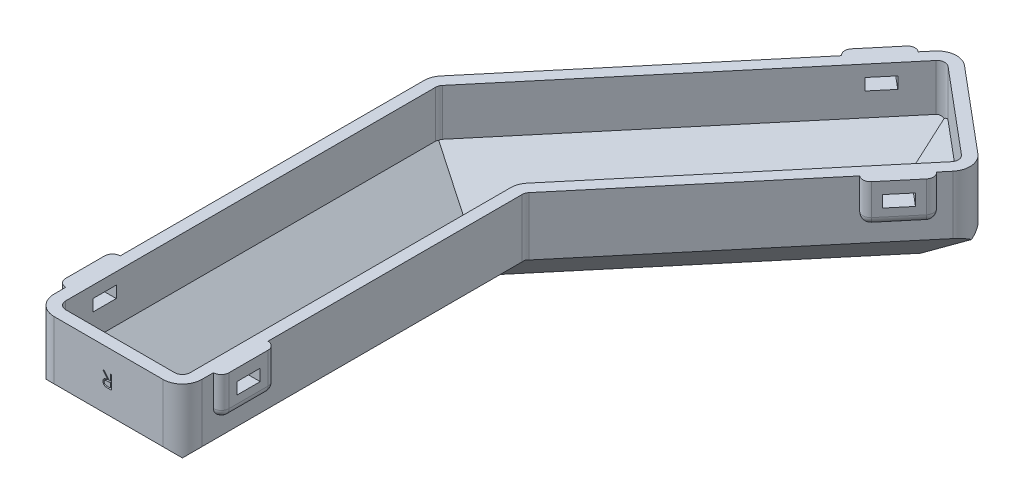
from build123d import *

# Parameters (mm, degrees)
BOSS_EXTRUDE1_DEPTH     = 25
CUT_EXTRUDE1_DEPTH      = 22
CHAMFER1_SIZE           = 10
FILLET1_R               = 2
FILLET2_R               = 5
SKETCH3_W               = 14
SKETCH3_H               = 10
BOSS_EXTRUDE2_DEPTH     = 2
SKETCH4_W               = 14
SKETCH4_H               = 10
BOSS_EXTRUDE3_DEPTH     = 2
CUT_EXTRUDE2_DEPTH      = 111.216138206
CUT_EXTRUDE2_DEPTH_BACK = 111.216138206
SKETCH5_W               = 6
SKETCH5_H               = 3
SKETCH6_W               = 14
SKETCH6_H               = 10
BOSS_EXTRUDE4_DEPTH     = 2
SKETCH7_W               = 14
SKETCH7_H               = 10
BOSS_EXTRUDE5_DEPTH     = 2
CUT_EXTRUDE3_DEPTH      = 110.938912569
CUT_EXTRUDE3_DEPTH_BACK = 110.938912569
SKETCH8_W               = 6
SKETCH8_H               = 3
FILLET4_R               = 2
CUT_EXTRUDE4_DEPTH      = 0.5


with BuildPart() as part:
    # Sketch1 → Boss-Extrude1 (new body)
    with BuildSketch(Plane(origin=(0, 0, 0), x_dir=(1, 0, 0), z_dir=(0, 1, 0))):
        Polygon((19, -95), (19, -6.915434451), (72.405729291, 56.731035297), (43.296040453, 81.156964465), (-19, 6.915434451), (-19, -95), align=None)
    extrude(amount=BOSS_EXTRUDE1_DEPTH)

    # Sketch2 → Cut-Extrude1 (cut)
    with BuildSketch(Plane(origin=(0, 25, 0), x_dir=(1, 0, 0), z_dir=(0, 1, 0))):
        Polygon((43.665810953, 76.930468306), (68.179233133, 56.361264796), (16, -5.823523748), (16, -92), (-16, -92), (-16, 5.823523748), align=None)
    extrude(amount=-CUT_EXTRUDE1_DEPTH, mode=Mode.SUBTRACT)

    # Chamfer1
    chamfer1_edges = [part.edges().sort_by_distance(p)[0] for p in [
        (13.832905476, 3, -41.376996027),
        (55.922522043, 3, -66.645866551),
        (42.089616566, 3, -25.268870524),
        (16, 3, 48.911761874),
        (0, 3, 92),
        (-16, 3, 43.088238126),
        (-19, 0, 44.042282774),
        (12.148020226, 0, -44.036199458),
        (57.850884872, 0, -68.943999881),
        (45.702864646, 0, -24.907800423),
        (19, 0, 50.957717226),
        (0, 0, 95),
    ]]
    chamfer(chamfer1_edges, length=CHAMFER1_SIZE)

    # Fillet1
    fillet1_edges = [part.edges().sort_by_distance(p)[0] for p in [
        (19, 17.5, 6.915434451),
        (43.665810953, 19, -76.930468306),
        (68.179233133, 19, -56.361264796),
        (16, 19, 92),
        (-16, 19, 92),
        (-16, 19, -5.823523748),
    ]]
    fillet(fillet1_edges, radius=FILLET1_R)

    # Fillet2
    fillet2_edges = [part.edges().sort_by_distance(p)[0] for p in [
        (-19, 17.5, 95),
        (-19, 17.5, -6.915434451),
        (43.296040453, 17.5, -81.156964465),
        (72.405729291, 17.5, -56.731035297),
        (19, 17.5, 95),
        (16, 19, 5.823523748),
    ]]
    fillet(fillet2_edges, radius=FILLET2_R)

    # Sketch3 → Boss-Extrude2 (add)
    with BuildSketch(Plane(origin=(-14.554844419, 0, -12.212964584), x_dir=(-0.6427876096865406, 0, 0.7660444431189771), z_dir=(-0.766044443118977, 0, -0.6427876096865405))):
        with Locations((-75, 20)):
            Rectangle(SKETCH3_W, SKETCH3_H)
    extrude(amount=BOSS_EXTRUDE2_DEPTH)

    # Sketch4 → Boss-Extrude3 (add)
    with BuildSketch(Plane(origin=(14.554844419, 0, 12.212964584), x_dir=(0.6427876096865404, 0, -0.7660444431189771), z_dir=(0.7660444431189771, 0, 0.6427876096865404))):
        with Locations((75, 20)):
            Rectangle(SKETCH4_W, SKETCH4_H)
    extrude(amount=BOSS_EXTRUDE3_DEPTH)

    # Sketch5 → Cut-Extrude2 (cut, two sides: drawn at the far end of the back side and taken through both)
    with BuildSketch(Plane(origin=(16.086933305, 0, 13.498539803), x_dir=(0.64278760968654, 0, -0.7660444431189776), z_dir=(0.7660444431189775, 0, 0.6427876096865399)).offset(-CUT_EXTRUDE2_DEPTH_BACK)):
        with Locations((75, 20.5)):
            Rectangle(SKETCH5_W, SKETCH5_H)
    extrude(amount=CUT_EXTRUDE2_DEPTH + CUT_EXTRUDE2_DEPTH_BACK, mode=Mode.SUBTRACT)

    # Sketch6 → Boss-Extrude4 (add)
    with BuildSketch(Plane.ZY.offset(19)):
        with Locations((80, 20)):
            Rectangle(SKETCH6_W, SKETCH6_H)
    extrude(amount=BOSS_EXTRUDE4_DEPTH)

    # Sketch7 → Boss-Extrude5 (add)
    with BuildSketch(Plane(origin=(19, 0, 0), x_dir=(0, 0, -1), z_dir=(1, 0, 0))):
        with Locations((-80, 20)):
            Rectangle(SKETCH7_W, SKETCH7_H)
    extrude(amount=BOSS_EXTRUDE5_DEPTH)

    # Sketch8 → Cut-Extrude3 (cut, two sides: drawn at the far end of the back side and taken through both)
    with BuildSketch(Plane(origin=(21, 0, 0), x_dir=(0, 0, -1), z_dir=(1, 0, 0)).offset(-CUT_EXTRUDE3_DEPTH_BACK)):
        with Locations((-80, 20.5)):
            Rectangle(SKETCH8_W, SKETCH8_H)
    extrude(amount=CUT_EXTRUDE3_DEPTH + CUT_EXTRUDE3_DEPTH_BACK, mode=Mode.SUBTRACT)

    # Fillet4
    # the kernel refuses this fillet: 2 mm, written as the material it takes off along each edge
    with BuildSketch(Plane(origin=(36.868164356, 17, -73.496520034), x_dir=(-0.7660444431189771, 0, -0.6427876096865406), z_dir=(0.6427876096865406, 0, -0.7660444431189771))) as fillet4_piece_1_section:
        Polygon((0, 0), (FILLET4_R * 1.02, 0), (FILLET4_R * 1.02, -FILLET4_R * 1.02), (0, -FILLET4_R * 1.02), align=None)
    fillet4_piece_1 = extrude(amount=FILLET4_R * 1.02, mode=Mode.PRIVATE)
    fillet4_piece_1 = fillet4_piece_1 - Plane(origin=(36.868164356, 17, -73.496520034), x_dir=(0.5416752204197013, 0.7071067811865475, 0.4545194776720445), z_dir=(0.6427876096865406, 0, -0.7660444431189771)) * Sphere(FILLET4_R, mode=Mode.PRIVATE)
    add(fillet4_piece_1, mode=Mode.SUBTRACT)
    with BuildSketch(Plane(origin=(30.440288259, 17, -65.836075602), x_dir=(-0.7660444431189771, 0, -0.6427876096865406), z_dir=(0, -1, 0))) as fillet4_piece_2_section:
        Polygon((0, 0), (FILLET4_R * 1.02, 0), (FILLET4_R * 1.02, -FILLET4_R * 1.02), (0, -FILLET4_R * 1.02), align=None)
    fillet4_piece_2 = extrude(amount=FILLET4_R * 1.02, mode=Mode.PRIVATE)
    fillet4_piece_2 = fillet4_piece_2 - Plane(origin=(30.440288259, 17, -65.836075602), x_dir=(0.9961946980917457, -1.0048591735576166e-15, -0.08715574274765664), z_dir=(0, -1, 0)) * Sphere(FILLET4_R, mode=Mode.PRIVATE)
    add(fillet4_piece_2, mode=Mode.SUBTRACT)
    with BuildSketch(Plane(origin=(59.549977097, 17, -41.410146434), x_dir=(-0.6427876096865404, 0, 0.7660444431189771), z_dir=(0, -1, 0))) as fillet4_piece_3_section:
        Polygon((0, 0), (FILLET4_R * 1.02, 0), (FILLET4_R * 1.02, -FILLET4_R * 1.02), (0, -FILLET4_R * 1.02), align=None)
    fillet4_piece_3 = extrude(amount=FILLET4_R * 1.02, mode=Mode.PRIVATE)
    fillet4_piece_3 = fillet4_piece_3 - Plane(origin=(59.549977097, 17, -41.410146434), x_dir=(-0.08715574274765679, 0, -0.9961946980917457), z_dir=(0, -1, 0)) * Sphere(FILLET4_R, mode=Mode.PRIVATE)
    add(fillet4_piece_3, mode=Mode.SUBTRACT)
    with BuildSketch(Plane(origin=(65.977853194, 17, -49.070590865), x_dir=(0.7660444431189771, 0, 0.6427876096865404), z_dir=(0, -1, 0))) as fillet4_piece_4_section:
        Polygon((0, 0), (FILLET4_R * 1.02, 0), (FILLET4_R * 1.02, -FILLET4_R * 1.02), (0, -FILLET4_R * 1.02), align=None)
    fillet4_piece_4 = extrude(amount=FILLET4_R * 1.02, mode=Mode.PRIVATE)
    fillet4_piece_4 = fillet4_piece_4 - Plane(origin=(65.977853194, 17, -49.070590865), x_dir=(-0.9961946980917457, 0, 0.08715574274765679), z_dir=(0, -1, 0)) * Sphere(FILLET4_R, mode=Mode.PRIVATE)
    add(fillet4_piece_4, mode=Mode.SUBTRACT)
    with BuildSketch(Plane(origin=(-19, 17, 75), x_dir=(-1, 0, 0), z_dir=(0, 0, -1))) as fillet4_piece_5_section:
        Polygon((0, 0), (FILLET4_R * 1.02, 0), (FILLET4_R * 1.02, -FILLET4_R * 1.02), (0, -FILLET4_R * 1.02), align=None)
    fillet4_piece_5 = extrude(amount=FILLET4_R * 1.02, mode=Mode.PRIVATE)
    fillet4_piece_5 = fillet4_piece_5 - Plane(origin=(-19, 17, 75), x_dir=(0.7071067811865475, 0.7071067811865475, 0), z_dir=(0, 0, -1)) * Sphere(FILLET4_R, mode=Mode.PRIVATE)
    add(fillet4_piece_5, mode=Mode.SUBTRACT)
    with BuildSketch(Plane(origin=(-19, 17, 85), x_dir=(-1, 0, 0), z_dir=(0, -1, 0))) as fillet4_piece_6_section:
        Polygon((0, 0), (FILLET4_R * 1.02, 0), (FILLET4_R * 1.02, -FILLET4_R * 1.02), (0, -FILLET4_R * 1.02), align=None)
    fillet4_piece_6 = extrude(amount=FILLET4_R * 1.02, mode=Mode.PRIVATE)
    fillet4_piece_6 = fillet4_piece_6 - Plane(origin=(-19, 17, 85), x_dir=(0.7071067811865475, 0, -0.7071067811865475), z_dir=(0, -1, 0)) * Sphere(FILLET4_R, mode=Mode.PRIVATE)
    add(fillet4_piece_6, mode=Mode.SUBTRACT)
    with BuildSketch(Plane(origin=(19, 17, 85), x_dir=(0, -1, 0), z_dir=(1, 0, 0))) as fillet4_piece_7_section:
        Polygon((0, 0), (FILLET4_R * 1.02, 0), (FILLET4_R * 1.02, -FILLET4_R * 1.02), (0, -FILLET4_R * 1.02), align=None)
    fillet4_piece_7 = extrude(amount=FILLET4_R * 1.02, mode=Mode.PRIVATE)
    fillet4_piece_7 = fillet4_piece_7 - Plane(origin=(19, 17, 85), x_dir=(0, 0.7071067811865476, -0.7071067811865475), z_dir=(1, 0, 0)) * Sphere(FILLET4_R, mode=Mode.PRIVATE)
    add(fillet4_piece_7, mode=Mode.SUBTRACT)
    with BuildSketch(Plane(origin=(19, 17, 75), x_dir=(0, 0, -1), z_dir=(1, 0, 0))) as fillet4_piece_8_section:
        Polygon((0, 0), (FILLET4_R * 1.02, 0), (FILLET4_R * 1.02, -FILLET4_R * 1.02), (0, -FILLET4_R * 1.02), align=None)
    fillet4_piece_8 = extrude(amount=FILLET4_R * 1.02, mode=Mode.PRIVATE)
    fillet4_piece_8 = fillet4_piece_8 - Plane(origin=(19, 17, 75), x_dir=(0, 0.7071067811865475, 0.7071067811865477), z_dir=(1, 0, 0)) * Sphere(FILLET4_R, mode=Mode.PRIVATE)
    add(fillet4_piece_8, mode=Mode.SUBTRACT)
    with BuildSketch(Plane(origin=(36.621650689, 17, -76.314184139), x_dir=(0.7660444431189815, 0, 0.6427876096865355), z_dir=(0, 1, 0)), Plane(origin=(59.796490764, 17, -38.592482329), x_dir=(-0.7660444431189785, 0, -0.6427876096865388), z_dir=(0, 1, 0)), Plane(origin=(-21, 17, 73), x_dir=(1, 0, 0), z_dir=(0, 1, 0)), Plane(origin=(21, 17, 87), x_dir=(-1, 0, 0), z_dir=(0, 1, 0)), Plane(origin=(21, 30, 73), x_dir=(-1, 0, 0), z_dir=(0, -1, 0))) as fillet4_piece_9:
        with BuildLine():
            CenterArc((FILLET4_R, -FILLET4_R), FILLET4_R, 90, 90)
            Line((0, -FILLET4_R), (0, 0))
            Line((0, 0), (FILLET4_R, 0))
        make_face()
    extrude(amount=13, mode=Mode.SUBTRACT)
    with BuildSketch(Plane(origin=(28.908199373, 15, -67.121650822), x_dir=(0, 1, 0), z_dir=(0.6427876096865406, 0, -0.7660444431189771)), Plane(origin=(67.50994208, 15, -47.785015646), x_dir=(0, 1, 0), z_dir=(-0.6427876096865404, 0, 0.7660444431189771)), Plane(origin=(-21, 15, 85), x_dir=(0, 1, 0), z_dir=(0, 0, -1))) as fillet4_piece_10:
        with BuildLine():
            CenterArc((FILLET4_R, FILLET4_R), FILLET4_R, 180, 90)
            Line((0, FILLET4_R), (0, 0))
            Line((0, 0), (FILLET4_R, 0))
        make_face()
    extrude(amount=10, mode=Mode.SUBTRACT)
    with BuildSketch(Plane(origin=(27.622624153, 30, -65.589561936), x_dir=(0.6427876096865434, -1.4210854715202012e-15, -0.7660444431189747), z_dir=(0, -1, 0)), Plane(origin=(68.7955173, 30, -49.317104532), x_dir=(-0.6427876096865396, 0, 0.7660444431189779), z_dir=(0, -1, 0)), Plane(origin=(-21, 30, 87), x_dir=(0, 0, -1), z_dir=(0, -1, 0))) as fillet4_piece_11:
        with BuildLine():
            CenterArc((FILLET4_R, FILLET4_R), FILLET4_R, 180, 90)
            Line((0, FILLET4_R), (0, 0))
            Line((0, 0), (FILLET4_R, 0))
        make_face()
    extrude(amount=13, mode=Mode.SUBTRACT)
    with BuildSketch(Plane(origin=(21, 15, 75), x_dir=(-1, 0, 0), z_dir=(0, 0, 1))) as fillet4_piece_12:
        with BuildLine():
            CenterArc((FILLET4_R, -FILLET4_R), FILLET4_R, 90, 90)
            Line((0, -FILLET4_R), (0, 0))
            Line((0, 0), (FILLET4_R, 0))
        make_face()
    extrude(amount=10, mode=Mode.SUBTRACT)

    # Sketch9 → Cut-Extrude4 (cut)
    with BuildSketch(Plane.XY.offset(95)):
        with BuildLine():
            Line((0.770149808, 15.949853493), (0.069729135, 15.949853493))
            add(Edge.make_bspline(
                [(0.069729135, 15.949853493), (0.022988006, 15.950009079), (-0.066760138, 15.950307821), (-0.195333409, 15.951973584), (-0.312160506, 15.95674794), (-0.417180345, 15.960856524), (-0.510391, 15.968348465), (-0.592078291, 15.975509112), (-0.661865988, 15.984882773), (-0.704111839, 15.993588196), (-0.723239615, 15.997529775)],
                knots=[0, 0, 0, 0, 1.410062039, 2.707475311, 3.878576406, 4.937260626, 5.877586885, 6.699081471, 7.410979367, 8, 8, 8, 8], degree=3))
            add(Edge.make_bspline(
                [(-0.723239615, 15.997529775), (-0.748846671, 16.00385584), (-0.799514513, 16.016373018), (-0.872458324, 16.042842782), (-0.941995725, 16.07342491), (-1.007872068, 16.109619108), (-1.07007009, 16.150814191), (-1.128583525, 16.197175766), (-1.182627824, 16.249101056), (-1.234125799, 16.304439111), (-1.279093367, 16.365599283), (-1.319576108, 16.429477854), (-1.353559982, 16.497304646), (-1.380301499, 16.568737557), (-1.402719695, 16.643075866), (-1.417786816, 16.721054136), (-1.427170882, 16.802418665), (-1.428098028, 16.857779951), (-1.428568141, 16.885851089)],
                knots=[0, 0, 0, 0, 1.027276577, 2.032638556, 3.019345632, 3.985365262, 4.957888996, 5.923693931, 6.890056973, 7.876427719, 8.865527834, 9.843495157, 10.821038291, 11.815616373, 12.812734995, 13.843357168, 14.906466538, 16, 16, 16, 16], degree=3))
            add(Edge.make_bspline(
                [(-1.428568141, 16.885851089), (-1.427099181, 16.932486248), (-1.42423286, 17.02348352), (-1.397507223, 17.155543652), (-1.353732651, 17.278735708), (-1.293402188, 17.392888247), (-1.216609264, 17.495836267), (-1.124321632, 17.585953039), (-1.017010598, 17.662060759), (-0.916642043, 17.714277362), (-0.827939659, 17.747875763), (-0.754699989, 17.771634396), (-0.674747225, 17.789681372), (-0.589228411, 17.806083553), (-0.497482991, 17.818599734), (-0.399695717, 17.827488601), (-0.295622018, 17.833204211), (-0.224282256, 17.834039286), (-0.187582564, 17.834468878)],
                knots=[0, 0, 0, 0, 1.260402266, 2.459371274, 3.627181936, 4.786749125, 5.93865593, 7.087644312, 8.261344208, 9.485713728, 10.136162886, 10.825977872, 11.566646758, 12.35154167, 13.181268117, 14.0701832, 15.007234106, 16, 16, 16, 16], degree=3))
            Line((-0.187582564, 17.834468878), (-1.473439936, 19.449853493))
            Line((-1.473439936, 19.449853493), (-1.085018462, 19.449853493))
            Line((-1.085018462, 19.449853493), (0.20083891, 17.834468878))
            Line((0.20083891, 17.834468878), (0.456047244, 17.834468878))
            Line((0.456047244, 17.834468878), (0.456047244, 19.449853493))
            Line((0.456047244, 19.449853493), (0.770149808, 19.449853493))
            Line((0.770149808, 19.449853493), (0.770149808, 15.949853493))
        make_face()
        with BuildLine():
            Line((0.456047244, 16.308827852), (0.456047244, 17.475494519))
            Line((0.456047244, 17.475494519), (-0.184778077, 17.480402371))
            add(Edge.make_bspline(
                [(-0.184778077, 17.480402371), (-0.21469812, 17.480415616), (-0.272691684, 17.480441287), (-0.356592298, 17.476447408), (-0.434712583, 17.471904439), (-0.506752755, 17.464953926), (-0.572748236, 17.456001693), (-0.632655435, 17.444786189), (-0.686606738, 17.431774923), (-0.749329379, 17.411430804), (-0.820174706, 17.380589004), (-0.895580027, 17.332766113), (-0.96151982, 17.274931374), (-1.016341478, 17.20796185), (-1.060374295, 17.134013656), (-1.090959009, 17.054760347), (-1.111114158, 16.971450639), (-1.113335557, 16.914248523), (-1.114465577, 16.885149968)],
                knots=[0, 0, 0, 0, 1.146399208, 2.222048177, 3.218135709, 4.144938032, 4.994811973, 5.769438708, 6.479732432, 7.119818093, 8.294689872, 9.430121864, 10.527913442, 11.641375077, 12.733452768, 13.811150417, 14.886538365, 16, 16, 16, 16], degree=3))
            add(Edge.make_bspline(
                [(-1.114465577, 16.885149968), (-1.11327834, 16.856997889), (-1.11092567, 16.801210743), (-1.091279923, 16.719723609), (-1.059201529, 16.642240041), (-1.015294441, 16.569826261), (-0.960647361, 16.504580422), (-0.89699582, 16.448925629), (-0.825837681, 16.402689213), (-0.759869456, 16.372182313), (-0.700474821, 16.354232006), (-0.64914328, 16.341201897), (-0.590637341, 16.3320762), (-0.525645612, 16.323682996), (-0.453882588, 16.316575239), (-0.375304538, 16.311857459), (-0.289967646, 16.309037635), (-0.230820731, 16.308899407), (-0.200202756, 16.308827852)],
                knots=[0, 0, 0, 0, 1.100596872, 2.180981401, 3.259506136, 4.371595435, 5.481727359, 6.576991111, 7.667816242, 8.793363246, 9.406619729, 10.09427138, 10.864108636, 11.721733836, 12.6590937, 13.685439239, 14.801845161, 16, 16, 16, 16], degree=3))
            Line((-0.200202756, 16.308827852), (0.456047244, 16.308827852))
        make_face(mode=Mode.SUBTRACT)
    extrude(amount=-CUT_EXTRUDE4_DEPTH, mode=Mode.SUBTRACT)


solid = part.part
